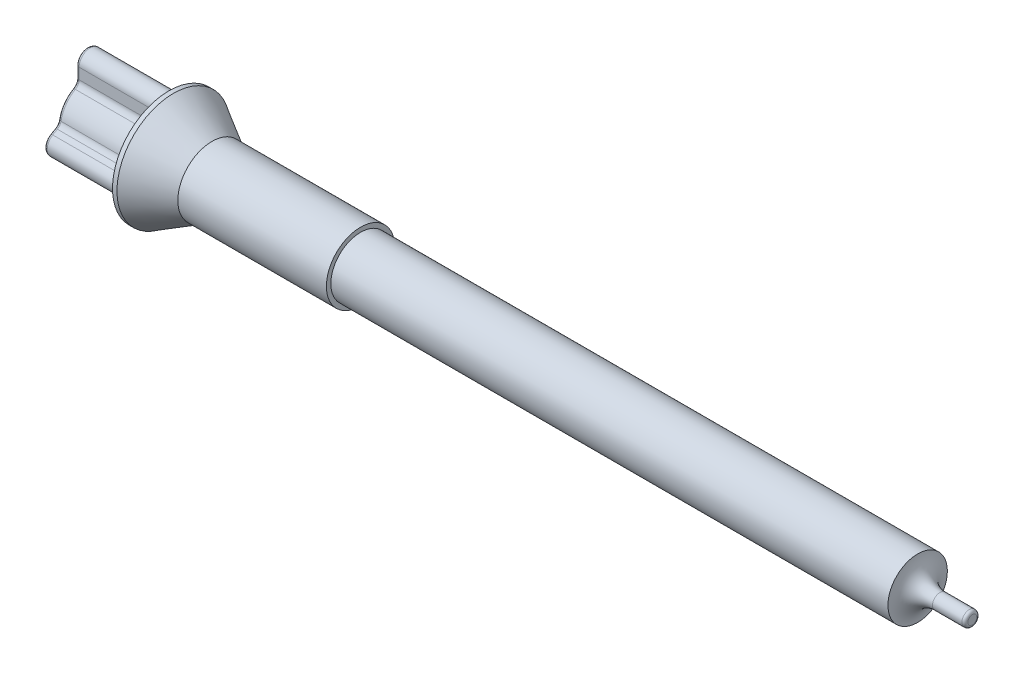
from build123d import *

# Parameters (mm, degrees)
BOSS_EXTRUDE1_REACH = 30.078
CIRPATTERN1_COUNT   = 3
FILLET1_R           = 0.25
SKETCH3_R           = 0.25
BOSS_EXTRUDE2_DEPTH = 1.84
FILLET2_R           = 0.75
FILLET3_R           = 0.1


# Some blends are built 0.0001 mm under size
with BuildPart() as part:
    # Sketch1 → Revolve1 (revolve)
    with BuildSketch(Plane.XY, mode=Mode.PRIVATE) as revolve1_sk:
        Polygon((0, 0), (0, 1), (2.75, 1), (2.75, 1.9), (2.9, 1.9), (4.199038106, 1.15), (9.199038106, 1.15), (9.199038106, 1), (27.949038106, 1), (27.949038106, 0), align=None)
    revolve(revolve1_sk.sketch.rotate(Axis((27.949038106, 0, 0), (-1, 0, 0)), 90), axis=Axis((27.949038106, 0, 0), (-1, 0, 0)))

    # Sketch2 → Boss-Extrude1 (add, up to next)
    with BuildSketch(Plane.ZY, mode=Mode.PRIVATE) as boss_extrude1_sk1:
        with BuildLine():
            Line((-0.375, 1.45), (-0.375, 0))
            Line((-0.375, 0), (0.375, 0))
            Line((0.375, 0), (0.375, 1.45))
            ThreePointArc((0.375, 1.45), (0, 1.825), (-0.375, 1.45))
        make_face()
    boss_extrude1_tool1 = extrude(boss_extrude1_sk1.sketch, amount=-BOSS_EXTRUDE1_REACH, mode=Mode.PRIVATE) - part.part
    boss_extrude1 = boss_extrude1_tool1.solids().sort_by_distance((0, 0.87427, 0))[0]
    add(boss_extrude1)

    # CirPattern1: Boss-Extrude1 ×3 about axis
    cirpattern1_axis = Axis((0, 0.211532174, 0), (1, 0, 0))
    for i in range(1, CIRPATTERN1_COUNT):
        add(boss_extrude1.rotate(cirpattern1_axis, i * 360 / CIRPATTERN1_COUNT))

    # Fillet1
    # the kernel refuses this fillet: 0.25 mm, written as the material it adds along each edge
    with BuildSketch(Plane(origin=(2.75, 0, 0), x_dir=(0, -0.09117875136969289, -0.9958345421296974), z_dir=(0, 0.9958345421296974, -0.09117875136969289))) as fillet1_piece_1:
        with BuildLine():
            CenterArc((1 + FILLET1_R, FILLET1_R), FILLET1_R, 180, 90)
            Line((1 + FILLET1_R, 0), (1, 0))
            Line((1, 0), (1, FILLET1_R))
        make_face()
    revolve(axis=Axis((2.75, 0, 0), (-1, 0, 0)), revolution_arc=169.537153176)
    with BuildSketch(Plane(origin=(0, -0.6568266534942833, 0.7540416084404763), x_dir=(0, -0.6965219560778457, -0.7175354797509959), z_dir=(1, 0, 0))) as fillet1_piece_2:
        with BuildLine():
            CenterArc((0.188004199, -0.249125741), FILLET1_R, 94.793076105, 65.958795366)
            Line((-0.048020748, -0.166710789), (-0.071623243, -0.158469294))
            ThreePointArc((-0.071623243, -0.158469294), (-0.065367462, -0.138688402), (-0.024049336, 0.006828574))
            Line((-0.024049336, 0.006828574), (0.002088936, 0.024912574))
            ThreePointArc((0.002088936, 0.024912574), (0.083557422, 0.021502964), (0.165025908, 0.024912574))
            Line((0.165025908, 0.024912574), (0.167114844, 0))
        make_face()
    extrude(amount=3.183722834)
    with BuildSketch(Plane(origin=(0, -0.656826653494284, -0.7540416084404756), x_dir=(0, -0.6965219560778453, 0.7175354797509962), z_dir=(1, 0, 0))) as fillet1_piece_3:
        with BuildLine():
            CenterArc((0.188004199, 0.249125741), FILLET1_R, 199.248128529, 65.958795366)
            Line((-0.048020748, 0.166710789), (-0.071623243, 0.158469294))
            ThreePointArc((-0.071623243, 0.158469294), (-0.065367462, 0.138688402), (-0.024049336, -0.006828574))
            Line((-0.024049336, -0.006828574), (0.002088936, -0.024912574))
            ThreePointArc((0.002088936, -0.024912574), (0.083557422, -0.021502964), (0.165025908, -0.024912574))
            Line((0.165025908, -0.024912574), (0.167114844, 0))
        make_face()
    extrude(amount=3.183722834)
    with BuildSketch(Plane(origin=(2.75, 0, 0), x_dir=(0, 0.9711641108026849, 0.2384119751372198), z_dir=(0, -0.2384119751372198, 0.9711641108026849))) as fillet1_piece_4:
        with BuildLine():
            CenterArc((1 + FILLET1_R, FILLET1_R), FILLET1_R, 180, 90)
            Line((1 + FILLET1_R, 0), (1, 0))
            Line((1, 0), (1, FILLET1_R))
        make_face()
    revolve(axis=Axis((2.75, 0, 0), (-1, 0, 0)), revolution_arc=135.679107602)
    with BuildSketch(Plane(origin=(0, 0.0685528304016777, -0.9976474875645802), x_dir=(0, 0.9923177536097539, 0.12371530168451961), z_dir=(1, 0, 0))) as fillet1_piece_5:
        with BuildLine():
            CenterArc((0.124645656, -0.249616087), FILLET1_R, 93.175701317, 49.717726552)
            Line((-0.074733027, -0.098791219), (0, 0))
            ThreePointArc((0, 0), (0.055398069, -0.001535652), (0.110796138, 0))
        make_face()
    extrude(amount=3.059684622)
    with BuildSketch(Plane(origin=(0, 0.9270248108869579, -0.3750000000000001), x_dir=(0, -0.43856183362977924, -0.8987010170703524), z_dir=(1, 0, 0))) as fillet1_piece_6:
        with BuildLine():
            CenterArc((0.156475844, 0.249394707), FILLET1_R, 206.012156419, 60)
            Line((-0.06819941, 0.139754249), (0, 0))
            ThreePointArc((0, 0), (0.069544819, 0.002421172), (0.139089639, 0))
        make_face()
    extrude(amount=3.13876736)
    with BuildSketch(Plane(origin=(0, 0.06855283040167853, 0.99764748756458), x_dir=(0, -0.5000000000000007, 0.8660254037844383), z_dir=(1, 0, 0))) as fillet1_piece_7:
        with BuildLine():
            CenterArc((0.123873849, -0.25), FILLET1_R, 90, 49.717726552)
            ThreePointArc((-0.066843252, -0.088361553), (-0.032196921, -0.045107234), (0, 0))
            Line((0, 0), (0.123873849, 0))
        make_face()
    extrude(amount=3.059684622)
    with BuildSketch(Plane(origin=(2.75, 0, 0), x_dir=(0, -0.528234948639016, 0.8490982505201246), z_dir=(0, -0.8490982505201246, -0.528234948639016))) as fillet1_piece_8:
        with BuildLine():
            CenterArc((1 + FILLET1_R, FILLET1_R), FILLET1_R, 180, 90)
            Line((1 + FILLET1_R, 0), (1, 0))
            Line((1, 0), (1, FILLET1_R))
        make_face()
    revolve(axis=Axis((2.75, 0, 0), (-1, 0, 0)), revolution_arc=135.679107602)
    with BuildSketch(Plane(origin=(0, 0.9270248108869579, 0.37499999999999994), x_dir=(0, -0.4385618336297787, 0.8987010170703525), z_dir=(1, 0, 0))) as fillet1_piece_9:
        with BuildLine():
            CenterArc((0.156475844, -0.249394707), FILLET1_R, 93.987843581, 60)
            Line((-0.06819941, -0.139754249), (0, 0))
            ThreePointArc((0, 0), (0.069544819, -0.002421172), (0.139089639, 0))
        make_face()
    extrude(amount=3.13876736)

    # Sketch3 → Boss-Extrude2 (add)
    with BuildSketch(Plane(origin=(27.949038106, 0, 0), x_dir=(0, 0, -1), z_dir=(1, 0, 0))):
        Circle(SKETCH3_R)
    extrude(amount=BOSS_EXTRUDE2_DEPTH)

    # Fillet2
    fillet2_edges = [part.edges().sort_by_distance(p)[0] for p in [
        (27.949038106, 0, 0.25),
    ]]
    fillet(fillet2_edges, radius=FILLET2_R - 0.0001)  # a hair under: the kernel refuses the full size

    # Fillet3
    fillet3_edges = [part.edges().sort_by_distance(p)[0] for p in [
        (29.789038106, 0, 0.25),
        (0, 1.266265877, -0.375),
        (0, 1.825, 0),
        (0, -0.585494181, -1.402718565),
        (0, -0.038163153, 1.182484993),
        (0, -1, 0),
        (0, -0.585494181, 1.402718565),
        (0, 0.575592511791251, -0.8177366693317834),
        (0, -0.038163153, -1.182484993),
        (0, 0.5755925117912868, 0.8177366693317583),
        (0, 1.266265877, 0.375),
        (0, -0.718078705, 0.764899668),
        (0, -0.718078705, -0.764899668),
        (0, 0.079224129, -1.02549122),
        (0, 0.957531755, -0.408493649),
        (0, 0.079224129, 1.02549122),
        (0, 0.957531755, 0.408493649),
    ]]
    fillet(fillet3_edges, radius=FILLET3_R)


solid = part.part
